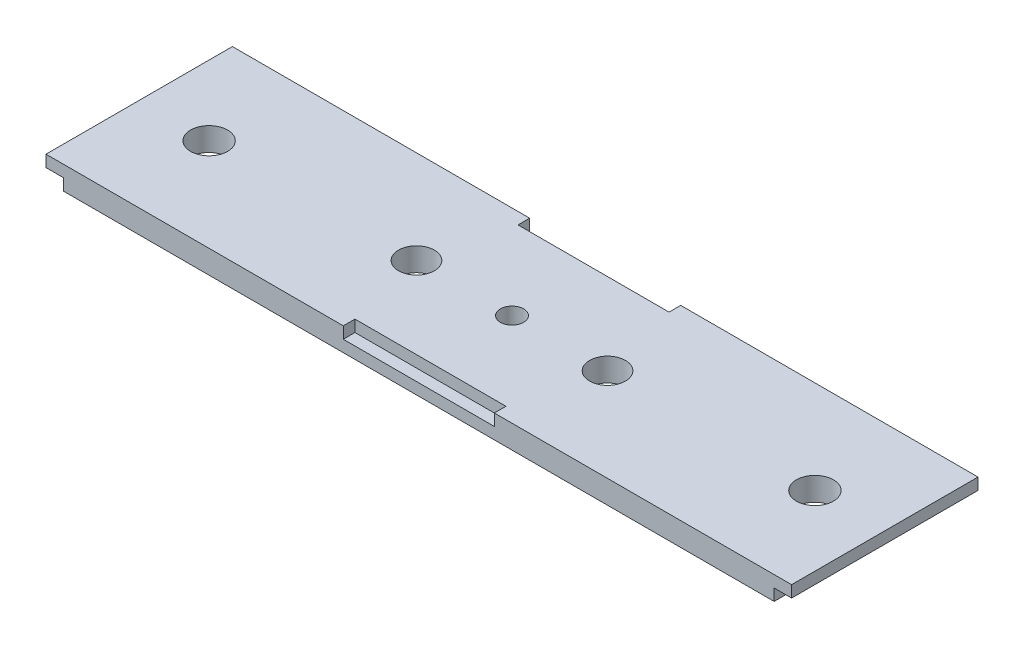
from build123d import *

# Parameters (mm, degrees)
SKETCH1_W           = 203.2
SKETCH1_H           = 50.8
SKETCH1_R           = 5.05
SKETCH1_R_2         = 3.175
BOSS_EXTRUDE1_DEPTH = 6.35
SKETCH2_W           = 41.159999976
SKETCH2_H           = 3.175
CUT_EXTRUDE1_DEPTH  = 3.175
SKETCH3_W           = 4.7625
SKETCH3_H           = 50.8
CUT_EXTRUDE2_DEPTH  = 3.175
SKETCH4_R           = 4.8895
CUT_EXTRUDE3_DEPTH  = 105.919218926


with BuildPart() as part:
    # Sketch1 → Boss-Extrude1 (new body)
    with BuildSketch(Plane(origin=(0, 0, 0), x_dir=(1, 0, 0), z_dir=(0, 1, 0))):
        Rectangle(SKETCH1_W, SKETCH1_H)
        with Locations((-82.55, 0)):
            Circle(SKETCH1_R, mode=Mode.SUBTRACT)
        with Locations((82.55, 0)):
            Circle(SKETCH1_R, mode=Mode.SUBTRACT)
        Circle(SKETCH1_R_2, mode=Mode.SUBTRACT)
    extrude(amount=BOSS_EXTRUDE1_DEPTH)

    # Sketch2 → Cut-Extrude1 (cut)
    with BuildSketch(Plane(origin=(0, 6.35, 0), x_dir=(1, 0, 0), z_dir=(0, 1, 0))):
        with Locations((0, -23.8125)):
            Rectangle(SKETCH2_W, SKETCH2_H)
        with Locations((0, 23.8125)):
            Rectangle(SKETCH2_W, SKETCH2_H)
    extrude(amount=-CUT_EXTRUDE1_DEPTH, mode=Mode.SUBTRACT)

    # Sketch3 → Cut-Extrude2 (cut)
    with BuildSketch(Plane.XZ):
        with Locations((-99.21875, 0)):
            Rectangle(SKETCH3_W, SKETCH3_H)
        with Locations((99.21875, 0)):
            Rectangle(SKETCH3_W, SKETCH3_H)
    extrude(amount=-CUT_EXTRUDE2_DEPTH, mode=Mode.SUBTRACT)

    # Sketch4 → Cut-Extrude3 (cut, through all)
    with BuildSketch(Plane(origin=(0, 6.35, 0), x_dir=(1, 0, 0), z_dir=(0, 1, 0))):
        with Locations((-26.035, 0)):
            Circle(SKETCH4_R)
        with Locations((26.035, 0)):
            Circle(SKETCH4_R)
    extrude(amount=-CUT_EXTRUDE3_DEPTH, mode=Mode.SUBTRACT)


solid = part.part
